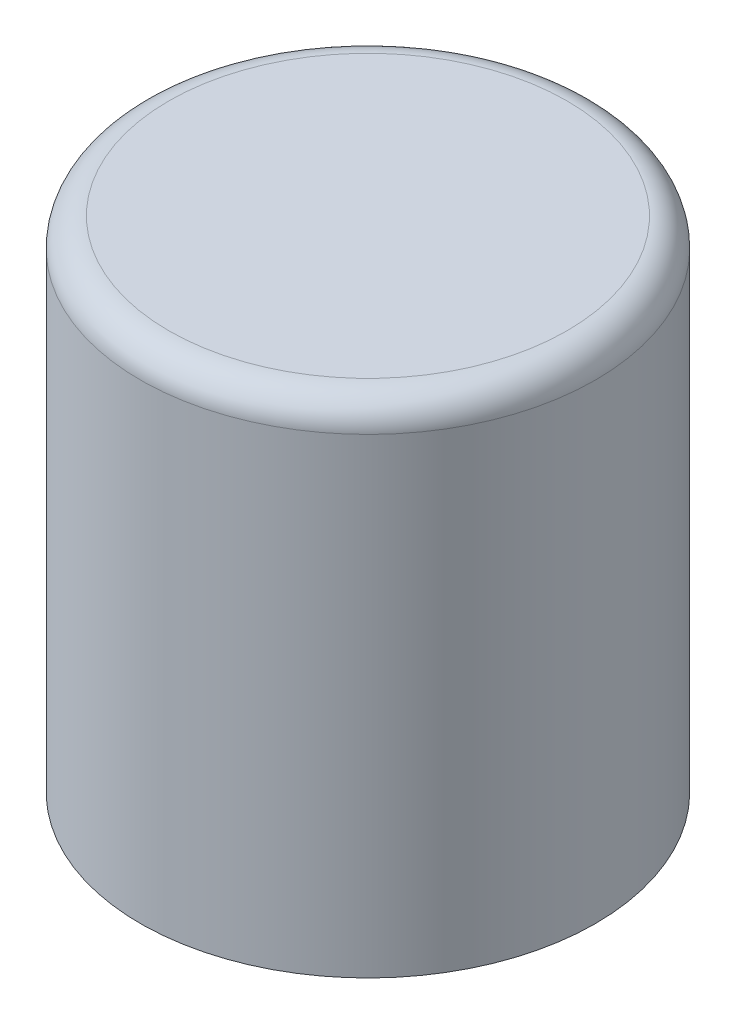
from build123d import *

# Parameters (mm, degrees)
CONG_1_R = 2


with BuildPart() as part:
    # Esquisse1 → Révolution1 (revolve)
    with BuildSketch(Plane.XY):
        Polygon((-16, 0), (-16, 35.1), (0, 35.1), (0, 32.1), (-12.5, 32.1), (-12.5, 12.6), (-12.5, 9.3), (-9, 9.3), (-9, 6.3), (-12.5, 6.3), (-12.5, 3), (-9, 3), (-9, 0), (-12.5, 0), align=None)
    revolve(axis=Axis((0, 0, 0), (0, 1, 0)))

    # Congé1
    cong_1_edges = [part.edges().sort_by_distance(p)[0] for p in [
        (16, 35.1, 0),
    ]]
    fillet(cong_1_edges, radius=CONG_1_R)


solid = part.part
